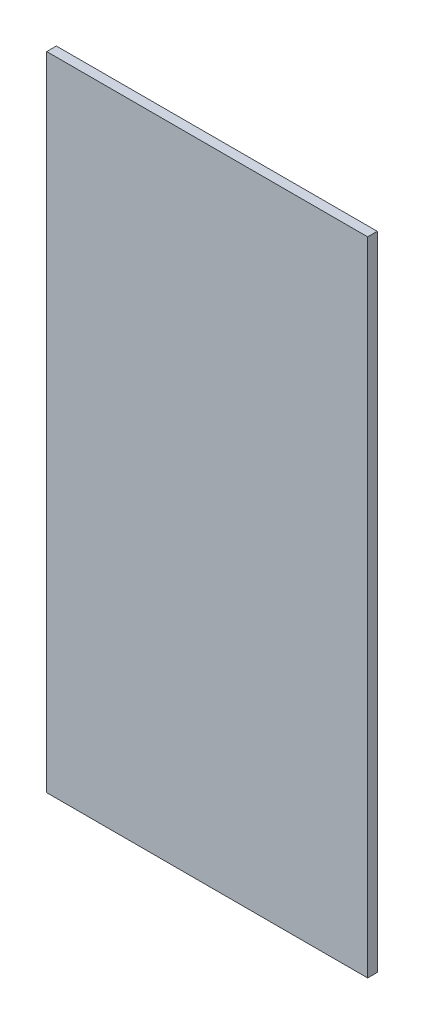
from build123d import *

# Parameters (mm, degrees)
SKETCH1_W           = 200
SKETCH1_H           = 400
BOSS_EXTRUDE1_DEPTH = 6


with BuildPart() as part:
    # Sketch1 → Boss-Extrude1 (new body)
    with BuildSketch(Plane.XY):
        with Locations((71.428571429, 177.104761905)):
            Rectangle(SKETCH1_W, SKETCH1_H)
    extrude(amount=BOSS_EXTRUDE1_DEPTH)


solid = part.part
